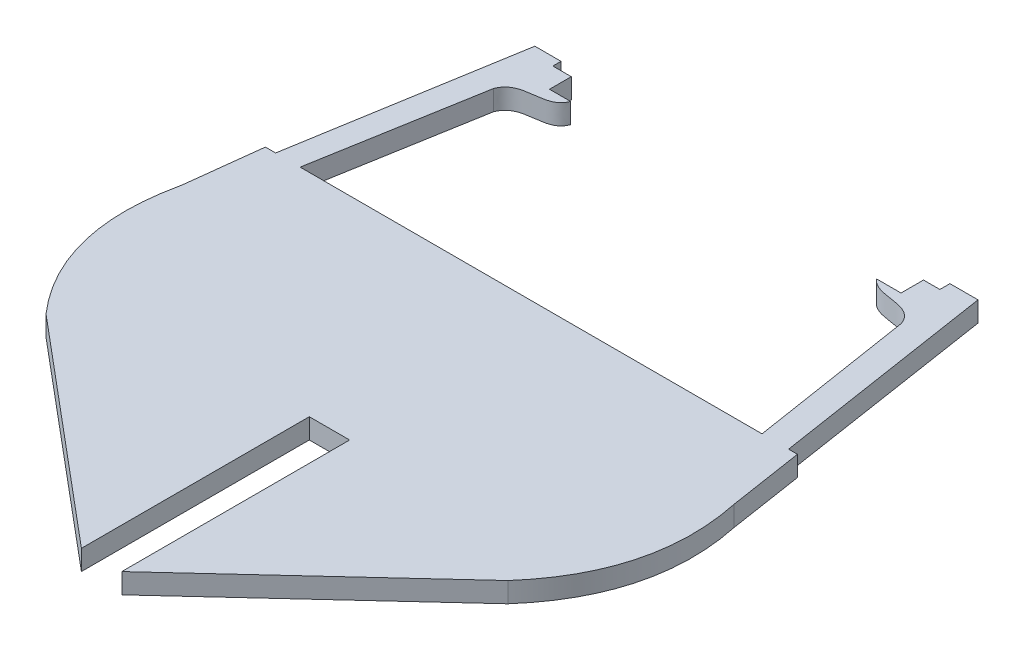
from build123d import *

# Parameters (mm, degrees)
EXTRUDE_1_DEPTH = 4


with BuildPart() as part:
    # 草图1 → 凸台-拉伸1 (new body)
    with BuildSketch(Plane(origin=(0, 0, 0), x_dir=(1, 0, 0), z_dir=(0, 1, 0))):
        with BuildLine():
            Line((100.951714286, -14.865714286), (98.654285714, 0))
            Line((98.654285714, 0), (96.897428571, 0))
            Line((96.897428571, 0), (90.030177392, 44.435154688))
            Line((90.030177392, 44.435154688), (84.464285714, 44.435154688))
            Line((84.464285714, 44.435154688), (84.464285714, 42.434857143))
            Line((84.464285714, 42.434857143), (81.220857143, 42.434857143))
            Line((81.220857143, 42.434857143), (81.220857143, 37.975142857))
            Line((81.220857143, 37.975142857), (76.355714286, 37.975142857))
            add(Edge.make_bspline(
                [(76.355714286, 37.975142857), (79.054861941, 34.714113191), (84.927529352, 37.397279792), (86.491428571, 32.704571429)],
                knots=[0, 0, 0, 0, 1, 1, 1, 1], degree=3))
            Line((86.491428571, 32.704571429), (91.626857143, 0))
            Line((91.626857143, 0), (0, 0))
            Line((0, 0), (5.676, 32.704571429))
            add(Edge.make_bspline(
                [(15.541428571, 38.110285714), (13.960851709, 34.001342708), (7.462533488, 37.242206471), (5.676, 32.704571429)],
                knots=[0, 0, 0, 0, 1, 1, 1, 1], degree=3))
            Line((15.541428571, 38.110285714), (11.352, 38.110285714))
            Line((11.352, 38.110285714), (11.352, 42.434857143))
            Line((11.352, 42.434857143), (7.703142857, 42.434857143))
            Line((7.703142857, 42.434857143), (7.703142857, 44.056571429))
            Line((7.703142857, 44.056571429), (2.504387055, 44.056571429))
            Line((2.504387055, 44.056571429), (-4.865142857, 0))
            Line((-4.865142857, 0), (-6.892285714, 0))
            Line((-6.892285714, 0), (-8.649142857, -14.865714286))
            add(Edge.make_bspline(
                [(-8.649142857, -14.865714286), (-13.153396154, -35.260594539), (0, -50.408285714)],
                knots=[0, 0, 0, 1, 1, 1], degree=2))
            Line((0, -50.408285714), (43.786285714, -87.167142857))
            Line((43.786285714, -87.167142857), (43.786285714, -41.967142857))
            Line((43.786285714, -41.967142857), (51.786285714, -41.967142857))
            Line((51.786285714, -41.967142857), (51.786285714, -87.167142857))
            Line((51.786285714, -87.167142857), (91.626857143, -50.408285714))
            add(Edge.make_bspline(
                [(100.951714286, -14.865714286), (105.198298687, -35.005928544), (91.626857143, -50.408285714)],
                knots=[0, 0, 0, 1, 1, 1], degree=2))
        make_face()
    extrude(amount=EXTRUDE_1_DEPTH)


solid = part.part
